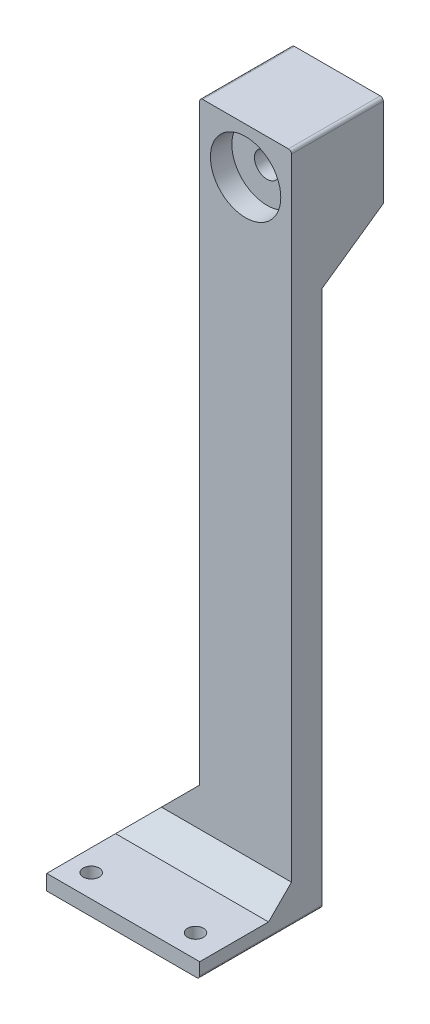
from build123d import *

# Parameters (mm, degrees)
SKETCH1_R                = 4.1
BOSS_EXTRUDE1_DEPTH      = 10
BOSS_EXTRUDE2_DEPTH      = 30
BOSS_EXTRUDE2_DEPTH_BACK = 10
SKETCH4_R                = 2.6
CUT_EXTRUDE1_DEPTH       = 20
CHAMFER1_SIZE            = 20
CHAMFER2_SIZE            = 7.5
SKETCH7_R                = 11.5
CUT_EXTRUDE2_DEPTH       = 7
BOSS_EXTRUDE4_START      = 13
SKETCH9_W                = 30
SKETCH9_H                = 30
SKETCH9_R                = 4.1
BOSS_EXTRUDE4_DEPTH      = 13
SKETCH8_W                = 30
SKETCH8_H                = 30
SKETCH8_R                = 11.4
BOSS_EXTRUDE3_DEPTH      = 7
CHAMFER3_SIZE2           = 14.004150764
CHAMFER3_SIZE            = 20
FILLET2_R                = 1


with BuildPart() as part:
    # Sketch1 → Boss-Extrude1 (new body)
    with BuildSketch(Plane.XY):
        Polygon((537.434015224, 195.609984424), (537.434015224, 0), (507.434015224, 0), (507.434015224, 184.690877396), (507.434015224, 219.575071586), (537.434015224, 219.575071586), align=None)
        with Locations((522.434015224, 204.575071586)):
            Circle(SKETCH1_R, mode=Mode.SUBTRACT)
    extrude(amount=BOSS_EXTRUDE1_DEPTH)

    # Sketch2 → Boss-Extrude2 (add, two sides: drawn at the far end of the back side and taken through both)
    with BuildSketch(Plane.XY.offset(10).offset(-BOSS_EXTRUDE2_DEPTH_BACK)):
        Polygon((507.434015224, 0), (537.434015224, 0), (537.434015224, 5), (507.434015224, 5), (487.434015224, 5), (487.434015224, 0), align=None)
    extrude(amount=BOSS_EXTRUDE2_DEPTH + BOSS_EXTRUDE2_DEPTH_BACK)

    # Sketch4 → Cut-Extrude1 (cut)
    with BuildSketch(Plane(origin=(0, 5, 0), x_dir=(1, 0, 0), z_dir=(0, 1, 0))):
        with Locations(Location((528.574793848, -32.5, 0), (0, 0, 270))):
            Circle(SKETCH4_R)
        with Locations(Location((494.484015224, -32.5, 0), (0, 0, 270))):
            Circle(SKETCH4_R)
    extrude(amount=-CUT_EXTRUDE1_DEPTH, mode=Mode.SUBTRACT)

    # Chamfer1
    chamfer1_edges = [part.edges().sort_by_distance(p)[0] for p in [
        (507.434015224, 5, 5),
    ]]
    chamfer(chamfer1_edges, length=CHAMFER1_SIZE - 0.0001)  # a hair under: the kernel refuses the full size

    # Chamfer2
    chamfer2_edges = [part.edges().sort_by_distance(p)[0] for p in [
        (512.434065224, 5, 10),
    ]]
    chamfer(chamfer2_edges, length=CHAMFER2_SIZE)

    # Sketch7 → Cut-Extrude2 (cut)
    with BuildSketch(Plane.XY.offset(10)):
        with Locations((522.434015224, 204.575071586)):
            Circle(SKETCH7_R)
    extrude(amount=-CUT_EXTRUDE2_DEPTH, mode=Mode.SUBTRACT)

    # Sketch9 → Boss-Extrude4 (add)
    with BuildSketch(Plane(origin=(0, 0, 0), x_dir=(-1, 0, 0), z_dir=(0, 0, -1)).offset(BOSS_EXTRUDE4_START)):
        with Locations((-522.434015224, 204.575071586)):
            Rectangle(SKETCH9_W, SKETCH9_H)
        with Locations((-522.434015224, 204.575071586)):
            Circle(SKETCH9_R, mode=Mode.SUBTRACT)
    extrude(amount=-BOSS_EXTRUDE4_DEPTH)

    # Sketch8 → Boss-Extrude3 (add)
    with BuildSketch(Plane(origin=(0, 0, -13), x_dir=(-1, 0, 0), z_dir=(0, 0, -1))):
        with Locations((-522.434015224, 204.575071586)):
            Rectangle(SKETCH8_W, SKETCH8_H)
        with Locations((-522.434015224, 204.575071586)):
            Circle(SKETCH8_R, mode=Mode.SUBTRACT)
    extrude(amount=BOSS_EXTRUDE3_DEPTH)

    # Chamfer3
    chamfer3_edges = [part.edges().sort_by_distance(p)[0] for p in [
        (522.434015224, 189.575071586, 0),
    ]]
    chamfer3_side = [part.faces().sort_by_distance(p)[0] for p in [
        (522.434015224, 189.575071586, -0.280083015),
    ]]
    chamfer(chamfer3_edges, length=CHAMFER3_SIZE - 0.0001, length2=CHAMFER3_SIZE2 - 0.0001, reference=chamfer3_side[0])  # a hair under: the kernel refuses the full size

    # Fillet2
    fillet2_edges = [part.edges().sort_by_distance(p)[0] for p in [
        (537.434015224, 0, 20),
        (507.434015224, 219.575071586, -5),
        (537.434015224, 219.575071586, -5),
    ]]
    fillet(fillet2_edges, radius=FILLET2_R)


solid = part.part
